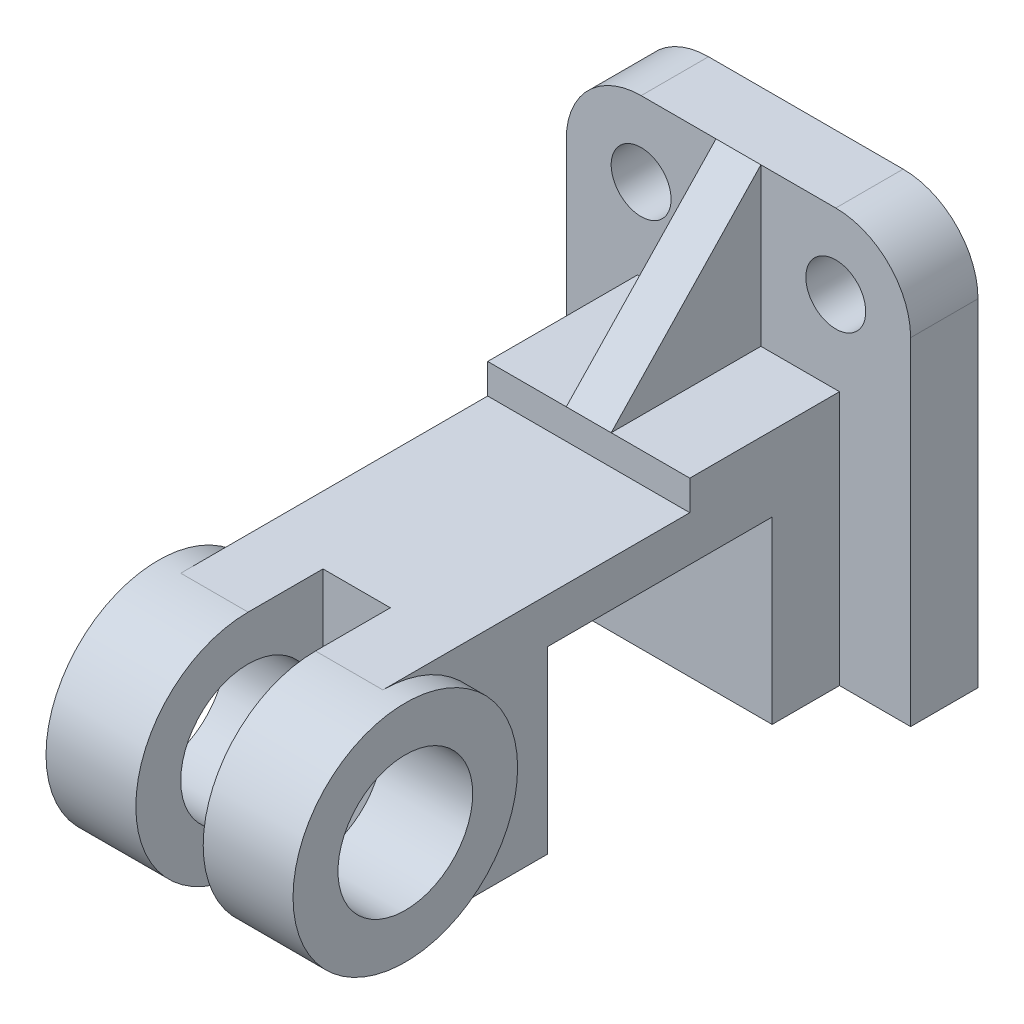
from build123d import *

# Parameters (mm, degrees)
SKETCH1_W                = 18
SKETCH1_H                = 110
BOSS_EXTRUDE1_DEPTH      = 46
BOSS_EXTRUDE2_DEPTH      = 27
FILLET1_R                = 30
BOSS_EXTRUDE3_DEPTH      = 6
BOSS_EXTRUDE3_DEPTH_BACK = 60
SKETCH3_R                = 30
FILLET3_R                = 20
SKETCH4_W                = 18
SKETCH4_H                = 50
CUT_EXTRUDE1_DEPTH       = 170.764542823
HOLE1_D                  = 36
HOLE2_D                  = 16
RIB1_REACH               = 195.184
SKETCH9_WALL_W           = 446.367700514
SKETCH9_WALL_H           = 12


with BuildPart() as part:
    # Sketch1 → Boss-Extrude1 (new, symmetric)
    with BuildSketch(Plane(origin=(0, 0, 0), x_dir=(0, 0, -1), z_dir=(1, 0, 0))):
        with Locations((9, 55)):
            Rectangle(SKETCH1_W, SKETCH1_H)
    extrude(amount=BOSS_EXTRUDE1_DEPTH, both=True)

    # Sketch2 → Boss-Extrude2 (add, symmetric)
    with BuildSketch(Plane(origin=(0, 0, 0), x_dir=(0, 0, -1), z_dir=(1, 0, 0))):
        Polygon((0, 0), (-18, 0), (-18, 48), (-78, 48), (-78, 0), (-152, 0), (-152, 60), (-40, 60), (-40, 68), (0, 68), align=None)
    extrude(amount=BOSS_EXTRUDE2_DEPTH, both=True)

    # Fillet1
    fillet1_edges = [part.edges().sort_by_distance(p)[0] for p in [
        (0, 0, 152),
        (0, 60, 152),
    ]]
    fillet(fillet1_edges, radius=FILLET1_R - 0.0001)  # a hair under: the kernel refuses the full size

    # Sketch3 → Boss-Extrude3 (add, two sides: drawn at the far end of the back side and taken through both)
    with BuildSketch(Plane(origin=(27, 0, 0), x_dir=(0, 0, -1), z_dir=(1, 0, 0)).offset(-BOSS_EXTRUDE3_DEPTH_BACK)):
        with Locations((-122, 30)):
            Circle(SKETCH3_R)
    extrude(amount=BOSS_EXTRUDE3_DEPTH + BOSS_EXTRUDE3_DEPTH_BACK)

    # Fillet3
    fillet3_edges = [part.edges().sort_by_distance(p)[0] for p in [
        (46, 110, -9),
        (-46, 110, -9),
    ]]
    fillet(fillet3_edges, radius=FILLET3_R)

    # Sketch4 → Cut-Extrude1 (cut, through all)
    with BuildSketch(Plane(origin=(0, 60, 0), x_dir=(1, 0, 0), z_dir=(0, 1, 0))):
        with Locations((0, -127)):
            Rectangle(SKETCH4_W, SKETCH4_H)
    extrude(amount=-CUT_EXTRUDE1_DEPTH, mode=Mode.SUBTRACT)

    # Hole1 (through all)
    with Locations(Plane(origin=(33, 0, 0), x_dir=(0, 0, -1), z_dir=(1, 0, 0))):
        with Locations((-122, 30)):
            Hole(HOLE1_D / 2)

    # Hole2 (through all)
    with Locations(Plane.XY):
        with Locations((26, 90), (-26, 90)):
            Hole(HOLE2_D / 2)

    # Sketch9 wall → Rib1 (add, up to next)
    with BuildSketch(Plane(origin=(0, 89, 20), x_dir=(0, -0.724137931034, 0.689655172414), z_dir=(0, -0.689655172414, -0.724137931034)), mode=Mode.PRIVATE) as rib1_sk1:
        Rectangle(SKETCH9_WALL_W, SKETCH9_WALL_H)
    rib1_tool1 = extrude(rib1_sk1.sketch, amount=RIB1_REACH, mode=Mode.PRIVATE) - part.part
    add(rib1_tool1.solids().sort_by_distance((0, 89, 20))[0])


solid = part.part
